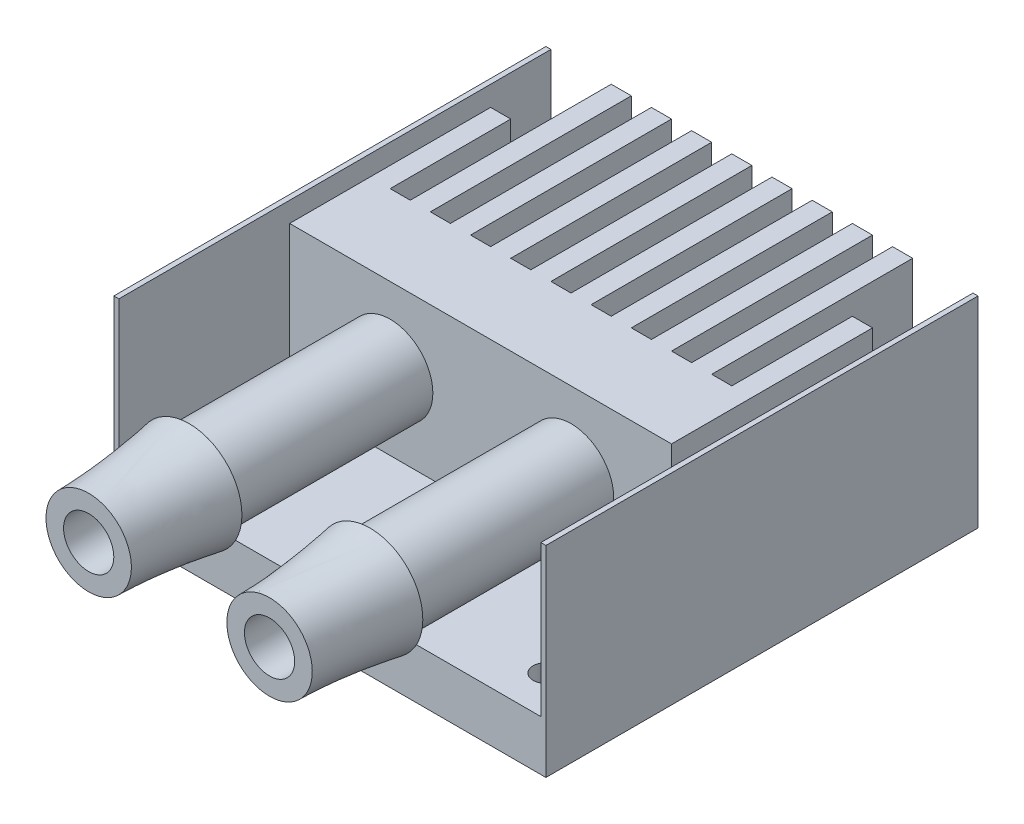
from build123d import *

# Parameters (mm, degrees)
SKETCH1_W               = 43
SKETCH1_H               = 43
BOSS_EXTRUDE1_DEPTH     = 20
SKETCH2_W               = 2
SKETCH2_H               = 15
CUT_EXTRUDE1_DEPTH      = 20
LPATTERN1_COUNT         = 6
LPATTERN1_PITCH         = 4
MIRROR1_COPY_1_SKETCH_W = 2
MIRROR1_COPY_1_SKETCH_H = 15
MIRROR1_COPY_1_DEPTH    = 20
MIRROR1_COPY_2_SKETCH_W = 2
MIRROR1_COPY_2_SKETCH_H = 15
MIRROR1_COPY_2_DEPTH    = 20
MIRROR1_COPY_3_SKETCH_W = 2
MIRROR1_COPY_3_SKETCH_H = 15
MIRROR1_COPY_3_DEPTH    = 20
MIRROR1_COPY_4_SKETCH_W = 2
MIRROR1_COPY_4_SKETCH_H = 15
MIRROR1_COPY_4_DEPTH    = 20
MIRROR1_COPY_5_SKETCH_W = 2
MIRROR1_COPY_5_SKETCH_H = 15
MIRROR1_COPY_5_DEPTH    = 20
MIRROR1_COPY_6_SKETCH_W = 2
MIRROR1_COPY_6_SKETCH_H = 15
MIRROR1_COPY_6_DEPTH    = 20
SKETCH7_W               = 2
SKETCH7_H               = 15
CUT_EXTRUDE6_DEPTH      = 38.299463803
SKETCH8_W               = 38
SKETCH8_H               = 15
CUT_EXTRUDE7_DEPTH      = 15
SKETCH9_R               = 4.25
BOSS_EXTRUDE2_DEPTH     = 20
SKETCH12_R              = 2.5
CUT_EXTRUDE8_DEPTH      = 35
SKETCH13_R              = 1.27
CUT_EXTRUDE9_DEPTH      = 47.845490789
SKETCH14_W              = 2
SKETCH14_H              = 8
CUT_EXTRUDE10_DEPTH     = 15


with BuildPart() as part:
    # Sketch1 → Boss-Extrude1 (new body)
    with BuildSketch(Plane(origin=(0, 0, 0), x_dir=(1, 0, 0), z_dir=(0, 1, 0))):
        Rectangle(SKETCH1_W, SKETCH1_H)
    extrude(amount=BOSS_EXTRUDE1_DEPTH)

    # Sketch2 → Cut-Extrude1 (cut)
    with BuildSketch(Plane(origin=(0, 0, -21.5), x_dir=(-1, 0, 0), z_dir=(0, 0, -1))):
        with Locations((0, 12.5)):
            Rectangle(SKETCH2_W, SKETCH2_H)
    cut_extrude1 = extrude(amount=-CUT_EXTRUDE1_DEPTH, mode=Mode.SUBTRACT)

    # LPattern1: Cut-Extrude1 ×6
    with Locations(*[(i * LPATTERN1_PITCH, 0, 0) for i in range(1, LPATTERN1_COUNT)]):
        add(cut_extrude1, mode=Mode.SUBTRACT)

    # Mirror1 copy 1 sketch → Mirror1 copy 1 (cut)
    with BuildSketch(Plane(origin=(-4, 0, -21.5), x_dir=(1, 0, 0), z_dir=(0, 0, -1))):
        with Locations((0, -12.5)):
            Rectangle(MIRROR1_COPY_1_SKETCH_W, MIRROR1_COPY_1_SKETCH_H)
    extrude(amount=-MIRROR1_COPY_1_DEPTH, mode=Mode.SUBTRACT)

    # Mirror1 copy 2 sketch → Mirror1 copy 2 (cut)
    with BuildSketch(Plane(origin=(-8, 0, -21.5), x_dir=(1, 0, 0), z_dir=(0, 0, -1))):
        with Locations((0, -12.5)):
            Rectangle(MIRROR1_COPY_2_SKETCH_W, MIRROR1_COPY_2_SKETCH_H)
    extrude(amount=-MIRROR1_COPY_2_DEPTH, mode=Mode.SUBTRACT)

    # Mirror1 copy 3 sketch → Mirror1 copy 3 (cut)
    with BuildSketch(Plane(origin=(-12, 0, -21.5), x_dir=(1, 0, 0), z_dir=(0, 0, -1))):
        with Locations((0, -12.5)):
            Rectangle(MIRROR1_COPY_3_SKETCH_W, MIRROR1_COPY_3_SKETCH_H)
    extrude(amount=-MIRROR1_COPY_3_DEPTH, mode=Mode.SUBTRACT)

    # Mirror1 copy 4 sketch → Mirror1 copy 4 (cut)
    with BuildSketch(Plane(origin=(-16, 0, -21.5), x_dir=(1, 0, 0), z_dir=(0, 0, -1))):
        with Locations((0, -12.5)):
            Rectangle(MIRROR1_COPY_4_SKETCH_W, MIRROR1_COPY_4_SKETCH_H)
    extrude(amount=-MIRROR1_COPY_4_DEPTH, mode=Mode.SUBTRACT)

    # Mirror1 copy 5 sketch → Mirror1 copy 5 (cut)
    with BuildSketch(Plane(origin=(-20, 0, -21.5), x_dir=(1, 0, 0), z_dir=(0, 0, -1))):
        with Locations((0, -12.5)):
            Rectangle(MIRROR1_COPY_5_SKETCH_W, MIRROR1_COPY_5_SKETCH_H)
    extrude(amount=-MIRROR1_COPY_5_DEPTH, mode=Mode.SUBTRACT)

    # Mirror1 copy 6 sketch → Mirror1 copy 6 (cut)
    with BuildSketch(Plane(origin=(0, 0, -21.5), x_dir=(1, 0, 0), z_dir=(0, 0, -1))):
        with Locations((0, -12.5)):
            Rectangle(MIRROR1_COPY_6_SKETCH_W, MIRROR1_COPY_6_SKETCH_H)
    extrude(amount=-MIRROR1_COPY_6_DEPTH, mode=Mode.SUBTRACT)

    # Sketch7 → Cut-Extrude6 (cut, through all)
    with BuildSketch(Plane(origin=(0, 0, -1.5), x_dir=(-1, 0, 0), z_dir=(0, 0, -1))):
        with Locations((20, 12.5)):
            Rectangle(SKETCH7_W, SKETCH7_H)
        with Locations((-20, 12.5)):
            Rectangle(SKETCH7_W, SKETCH7_H)
    extrude(amount=-CUT_EXTRUDE6_DEPTH, mode=Mode.SUBTRACT)

    # Sketch8 → Cut-Extrude7 (cut)
    with BuildSketch(Plane.XY.offset(21.5)):
        with Locations((0, 12.5)):
            Rectangle(SKETCH8_W, SKETCH8_H)
    extrude(amount=-CUT_EXTRUDE7_DEPTH, mode=Mode.SUBTRACT)

    # Sketch9 → Boss-Extrude2 (add)
    with BuildSketch(Plane.XY.offset(6.5)):
        with Locations((-9, 12.5)):
            Circle(SKETCH9_R)
    boss_extrude2 = extrude(amount=BOSS_EXTRUDE2_DEPTH)

    # Loft1: read off the stored shape, not the designer's step
    # Loft1: loft between two sections, ruled curve by curve
    loft1_from = [
        Edge.make_bspline([(-10.350301356, 17.57338016, 26.5), (-20.497061676, 14.872777448, 26.5), (-17.796458964, 4.726017128, 26.5), (-7.649698644, 7.42661984, 26.5), (2.497061676, 10.127222552, 26.5), (-0.203541036, 20.273982872, 26.5), (-10.350301356, 17.57338016, 26.5)], [0, 0, 0, 0, 0.5, 0.5, 0.5, 1, 1, 1, 1], 3, [1, 0.333333333, 0.333333333, 1, 0.333333333, 0.333333333, 1]),
    ]
    loft1_to = [
        Edge.make_bspline([(-7.69684054, 16.545278164, 36.5), (-15.787396868, 19.151597083, 36.5), (-18.393715787, 11.061040755, 36.5), (-10.30315946, 8.454721836, 36.5), (-2.212603132, 5.848402917, 36.5), (0.393715787, 13.938959245, 36.5), (-7.69684054, 16.545278164, 36.5)], [0, 0, 0, 0, 0.5, 0.5, 0.5, 1, 1, 1, 1], 3, [1, 0.333333333, 0.333333333, 1, 0.333333333, 0.333333333, 1]),
    ]
    loft1 = Solid(Shell([*[Face.make_surface_from_curves(loft1_from[k], loft1_to[k]) for k in range(1)], Face(Wire(loft1_from)), Face(Wire(loft1_to))]))
    add(loft1)

    # Sketch12 → Cut-Extrude8 (cut)
    with BuildSketch(Plane.XY.offset(36.5)):
        with Locations((-9, 12.5)):
            Circle(SKETCH12_R)
    cut_extrude8 = extrude(amount=-CUT_EXTRUDE8_DEPTH, mode=Mode.SUBTRACT)

    # Mirror3: Boss-Extrude2, Loft1, Cut-Extrude8 across plane
    add(boss_extrude2.mirror(Plane(origin=(0, 0, 0), x_dir=(0, 0, 1), z_dir=(1, 0, 0))))
    add(loft1.mirror(Plane(origin=(0, 0, 0), x_dir=(0, 0, 1), z_dir=(1, 0, 0))))
    add(cut_extrude8.mirror(Plane(origin=(0, 0, 0), x_dir=(0, 0, 1), z_dir=(1, 0, 0))), mode=Mode.SUBTRACT)

    # Sketch13 → Cut-Extrude9 (cut, through all)
    with BuildSketch(Plane.XZ):
        with Locations(Location((17.5, 17.5, 0), (0, 0, 270))):
            Circle(SKETCH13_R)
        with Locations(Location((-17.5, 17.5, 0), (0, 0, 270))):
            Circle(SKETCH13_R)
        with Locations(Location((-17.5, -17.5, 0), (0, 0, 270))):
            Circle(SKETCH13_R)
        with Locations(Location((17.5, -17.5, 0), (0, 0, 270))):
            Circle(SKETCH13_R)
    extrude(amount=-CUT_EXTRUDE9_DEPTH, mode=Mode.SUBTRACT)

    # Sketch14 → Cut-Extrude10 (cut)
    with BuildSketch(Plane(origin=(0, 20, 0), x_dir=(1, 0, 0), z_dir=(0, 1, 0))):
        with Locations((-18, 17.5)):
            Rectangle(SKETCH14_W, SKETCH14_H)
        with Locations((18, 17.5)):
            Rectangle(SKETCH14_W, SKETCH14_H)
    extrude(amount=-CUT_EXTRUDE10_DEPTH, mode=Mode.SUBTRACT)


solid = part.part
